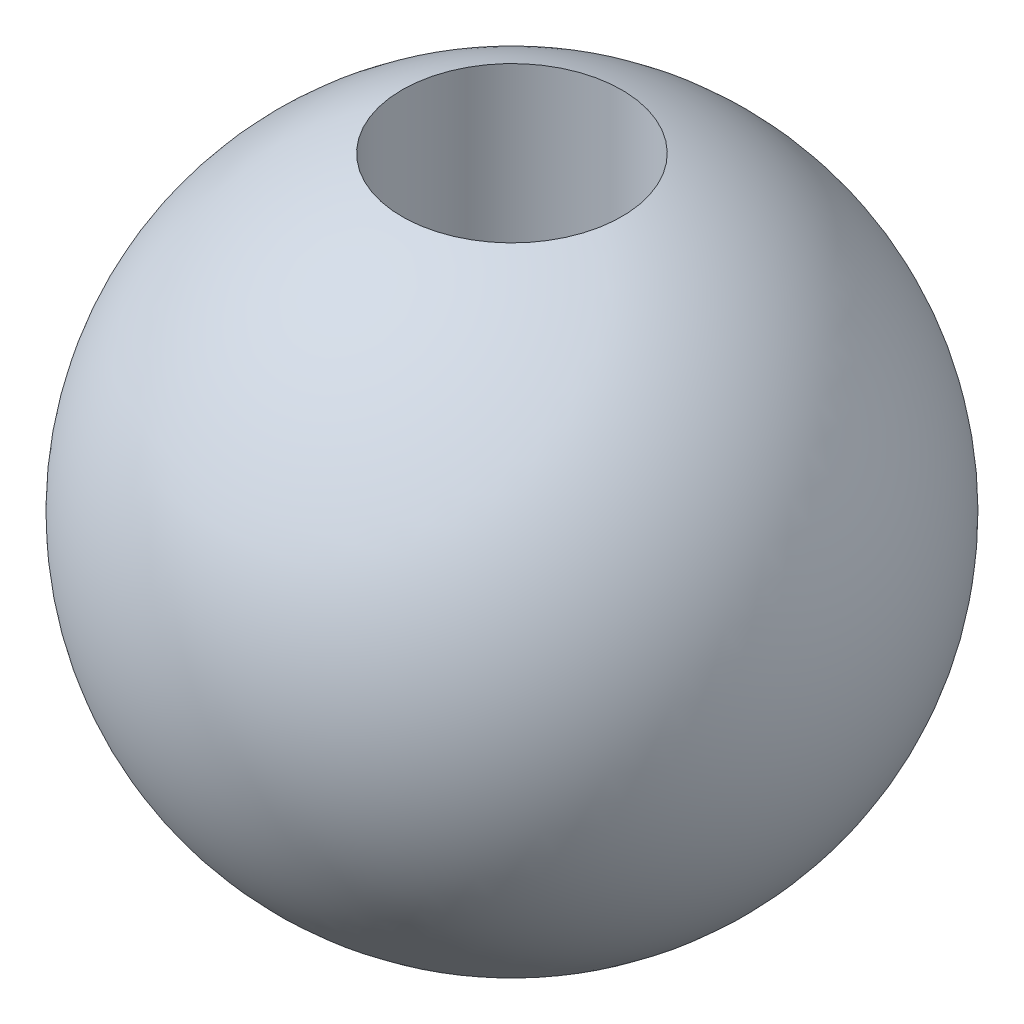
from build123d import *

# Parameters (mm, degrees)
ENL_V_DE_MAT_R_VOL_MINCE1_OUTLINE_R = 1
ENL_V_DE_MAT_R_VOL_MINCE1_DEPTH     = 6


# Read off the part's stored shape, not the designer's step: Enlèv. de mat.-Révol.-Mince1
with BuildPart() as part:
    # Esquisse1 → Révolution1 (revolve)
    with BuildSketch(Plane.XY):
        with BuildLine():
            Line((0, 6), (0, 0))
            ThreePointArc((0, 0), (3, 3), (0, 6))
        make_face()
    revolve(axis=Axis((0, 0, 0), (0, 1, 0)))

    # Enlèv. de mat.-Révol.-Mince1 outline → Enlèv. de mat.-Révol.-Mince1 (cut)
    with BuildSketch(Plane(origin=(0, 0, 0), x_dir=(1, 0, 0), z_dir=(0, 1, 0))):
        Circle(ENL_V_DE_MAT_R_VOL_MINCE1_OUTLINE_R)
    extrude(amount=ENL_V_DE_MAT_R_VOL_MINCE1_DEPTH, mode=Mode.SUBTRACT)


solid = part.part
